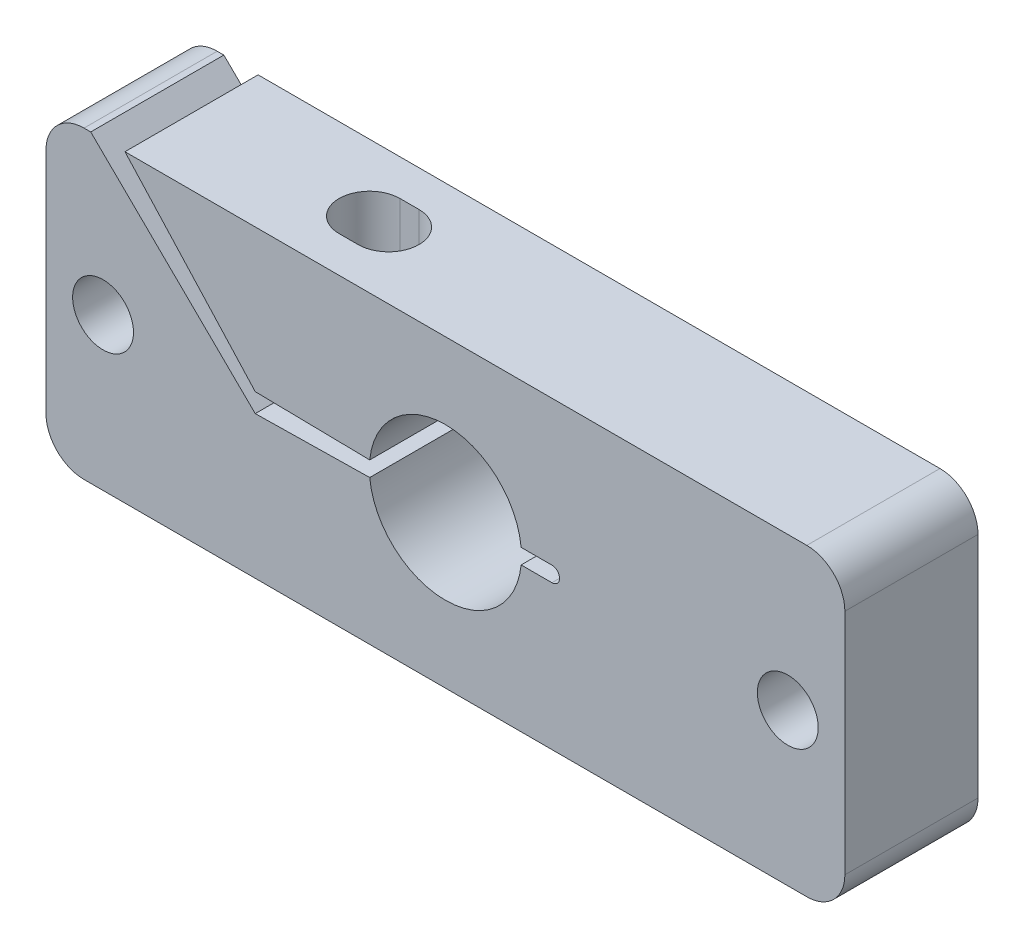
from build123d import *

# Parameters (mm, degrees)
BOSS_EXTRUDE1_DEPTH      = 3.5
BOSS_EXTRUDE1_DEPTH_BACK = 3.5
SKETCH1_R                = 1.6
CUT_EXTRUDE1_REACH       = 28.632
SKETCH3_R                = 1.6
SKETCH3_3_R              = 2.2
SKETCH3_3_R_2            = 1.6
CUT_EXTRUDE2_DEPTH       = 6
CUT_EXTRUDE3_REACH       = 28.632
FILLET1_R                = 2
FILLET2_R                = 0.4


with BuildPart() as part:
    # Sketch1 → Boss-Extrude1 (new, two sides: drawn at the far end of the back side and taken through both)
    with BuildSketch(Plane.XY.offset(-BOSS_EXTRUDE1_DEPTH_BACK)):
        with BuildLine():
            Line((-21, 8), (-18.64966284, 8))
            Line((-18.64966284, 8), (-10, -0.5))
            Line((-10, -0.5), (-3.979949748, -0.4))
            ThreePointArc((-3.979949748, -0.4), (0, -4), (3.979949748, -0.4))
            Line((3.979949748, -0.4), (6, -0.4))
            Line((6, -0.4), (6, 0.4))
            Line((6, 0.4), (3.979949748, 0.4))
            ThreePointArc((3.979949748, 0.4), (0, 4), (-3.979949748, 0.4))
            Line((-3.979949748, 0.4), (-10, 0.5))
            Line((-10, 0.5), (-16.848441102, 8))
            Line((-16.848441102, 8), (21, 8))
            Line((21, 8), (21, -8))
            Line((21, -8), (-21, -8))
            Line((-21, -8), (-21, 8))
        make_face()
        with Locations((-18, 0)):
            Circle(SKETCH1_R, mode=Mode.SUBTRACT)
        with Locations(Location((18, 0, 0), (0, 0, 180))):
            Circle(SKETCH1_R, mode=Mode.SUBTRACT)
    extrude(amount=BOSS_EXTRUDE1_DEPTH + BOSS_EXTRUDE1_DEPTH_BACK)

    # Cut-Extrude1: up to this plane
    cut_extrude1_end = Plane(origin=(-10, -0.5, -3.5), z_dir=(-0.016608865731892127, 0.9998620632762801, 0))
    # Sketch3 → Cut-Extrude1 (cut, up to the surface)
    with BuildSketch(Plane.XZ.offset(8), mode=Mode.PRIVATE) as cut_extrude1_sk1:
        with Locations(Location((-6.989974874, 0, 0), (0, 0, 270))):
            Circle(SKETCH3_R)
    cut_extrude1_tool1 = split(extrude(cut_extrude1_sk1.sketch, amount=-CUT_EXTRUDE1_REACH, mode=Mode.PRIVATE), bisect_by=cut_extrude1_end, keep=Keep.BOTH, mode=Mode.PRIVATE)
    add(cut_extrude1_tool1.solids().sort_by_distance((-6.989975, -8, 0))[0], mode=Mode.SUBTRACT)

    # Sketch3<3> → Cut-Extrude2 (cut)
    with BuildSketch(Plane.XZ.offset(8)):
        with Locations(Location((-6.989974874, 0, 0), (0, 0, 270))):
            Circle(SKETCH3_3_R)
        with Locations(Location((-6.989974874, 0, 0), (0, 0, 270))):
            Circle(SKETCH3_3_R_2, mode=Mode.SUBTRACT)
    extrude(amount=-CUT_EXTRUDE2_DEPTH, mode=Mode.SUBTRACT)

    # Cut-Extrude3: up to this plane
    cut_extrude3_end = Plane(origin=(-10, 0.5, -3.5), z_dir=(-0.016608865731892127, -0.9998620632762801, 0))
    # Sketch4 → Cut-Extrude3 (cut, up to the surface)
    with BuildSketch(Plane(origin=(0, 8, 0), x_dir=(1, 0, 0), z_dir=(0, 1, 0)), mode=Mode.PRIVATE) as cut_extrude3_sk1:
        with BuildLine():
            Line((-7.489974874, 1.6), (-6.489974874, 1.6))
            ThreePointArc((-6.489974874, 1.6), (-4.889974874, 0), (-6.489974874, -1.6))
            Line((-6.489974874, -1.6), (-7.489974874, -1.6))
            ThreePointArc((-7.489974874, -1.6), (-9.089974874, 0), (-7.489974874, 1.6))
        make_face()
    cut_extrude3_tool1 = split(extrude(cut_extrude3_sk1.sketch, amount=-CUT_EXTRUDE3_REACH, mode=Mode.PRIVATE), bisect_by=cut_extrude3_end, keep=Keep.BOTH, mode=Mode.PRIVATE)
    add(cut_extrude3_tool1.solids().sort_by_distance((-6.989975, 8, 0))[0], mode=Mode.SUBTRACT)

    # Fillet1
    fillet1_edges = [part.edges().sort_by_distance(p)[0] for p in [
        (21, 8, 0),
        (21, -8, 0),
        (-21, -8, 0),
        (-21, 8, 0),
    ]]
    fillet(fillet1_edges, radius=FILLET1_R)

    # Fillet2
    fillet2_edges = [part.edges().sort_by_distance(p)[0] for p in [
        (6, -0.4, 0),
        (6, 0.4, 0),
    ]]
    fillet(fillet2_edges, radius=FILLET2_R - 0.0001)  # a hair under: the kernel refuses the full size


solid = part.part
